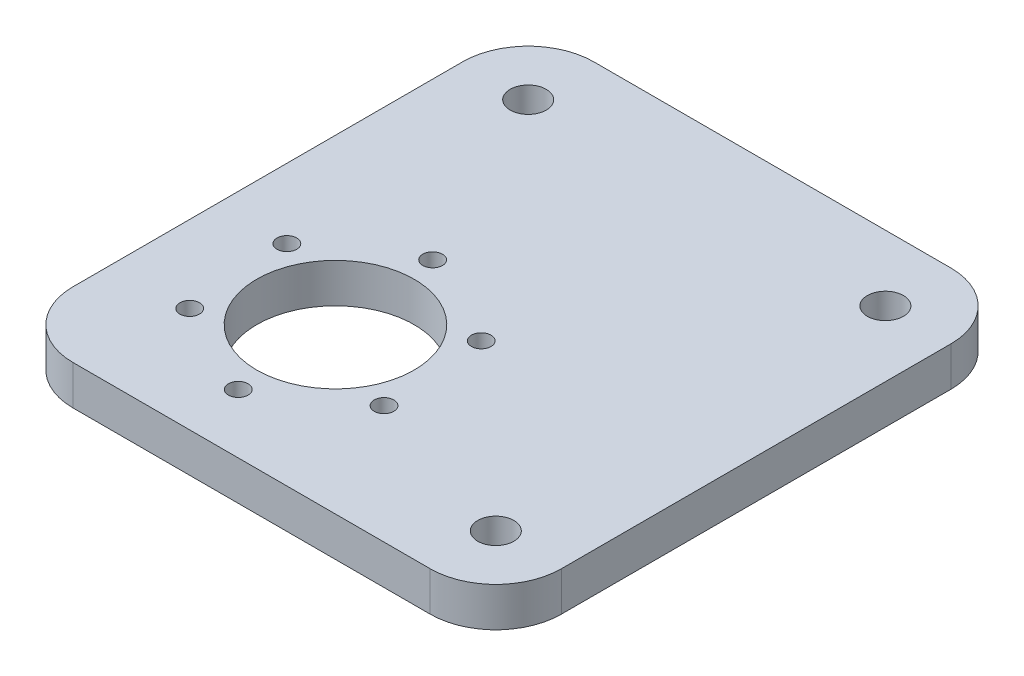
from build123d import *

# Parameters (mm, degrees)
SKETCH2_W           = 74.44
SKETCH2_H           = 79.38
SKETCH2_R           = 12
BOSS_EXTRUDE1_DEPTH = 6
SKETCH6_R           = 2.75
CUT_EXTRUDE2_DEPTH  = 10
SKETCH8_R           = 1.5
CUT_EXTRUDE4_DEPTH  = 78.515756065
FILLET1_R           = 10


with BuildPart() as part:
    # Sketch2 → Boss-Extrude1 (new body)
    with BuildSketch(Plane(origin=(0, 0, 0), x_dir=(1, 0, 0), z_dir=(0, 1, 0))):
        with Locations((18.526729133, 13.835644594)):
            Rectangle(SKETCH2_W, SKETCH2_H)
        with Locations((6.306729133, -0.854355406)):
            Circle(SKETCH2_R, mode=Mode.SUBTRACT)
    extrude(amount=BOSS_EXTRUDE1_DEPTH)

    # Sketch6 → Cut-Extrude2 (cut)
    with BuildSketch(Plane.XZ):
        with Locations((45.746729133, 15.854355406)):
            Circle(SKETCH6_R)
        with Locations((45.746729133, -43.525644594)):
            Circle(SKETCH6_R)
        with Locations((-8.693270867, -43.525644594)):
            Circle(SKETCH6_R)
    extrude(amount=-CUT_EXTRUDE2_DEPTH, mode=Mode.SUBTRACT)

    # Sketch8 → Cut-Extrude4 (cut, through all)
    with BuildSketch(Plane.XZ):
        with Locations((7.452065607, 16.813309143)):
            Circle(SKETCH8_R)
        with Locations((20.700256724, 7.841941792)):
            Circle(SKETCH8_R)
        with Locations((19.55492025, -8.117011944)):
            Circle(SKETCH8_R)
        with Locations((5.161392659, -15.10459833)):
            Circle(SKETCH8_R)
        with Locations((-8.086798457, -6.13323098)):
            Circle(SKETCH8_R)
        with Locations((-6.941461983, 9.825722757)):
            Circle(SKETCH8_R)
    extrude(amount=-CUT_EXTRUDE4_DEPTH, mode=Mode.SUBTRACT)

    # Fillet1
    fillet1_edges = [part.edges().sort_by_distance(p)[0] for p in [
        (55.746729133, 3, -53.525644594),
        (-18.693270867, 3, -53.525644594),
        (-18.693270867, 3, 25.854355406),
        (55.746729133, 3, 25.854355406),
    ]]
    fillet(fillet1_edges, radius=FILLET1_R)


solid = part.part
